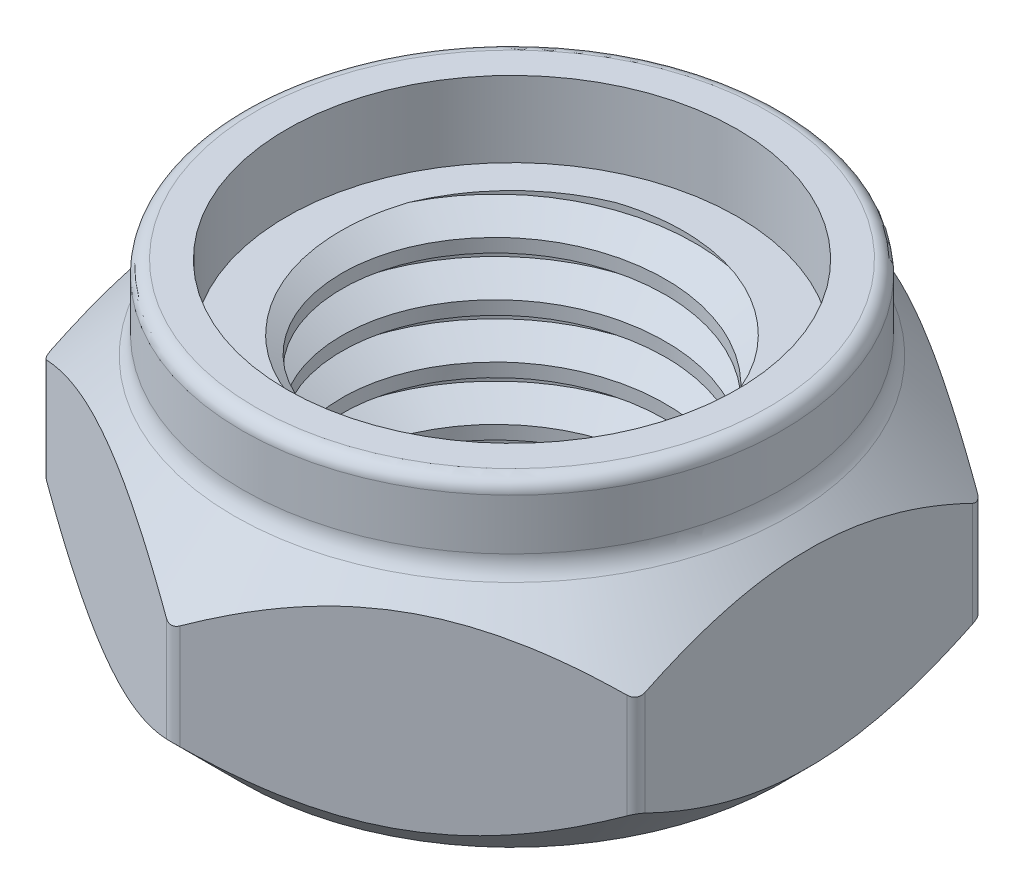
from build123d import *

# Parameters (mm, degrees)
BOSS_EXTRUDE1_DEPTH = 6
SKETCH2_R           = 3
CUT_EXTRUDE1_DEPTH  = 6
THREAD1_PITCH       = 1
SKETCH8_R           = 7.811523021
CUT_EXTRUDE3_DEPTH  = 1.5
SKETCH10_R          = 5
SKETCH10_R_2        = 4.175
BOSS_EXTRUDE2_DEPTH = 1.4
FILLET1_R           = 0.5
FILLET2_R           = 0.25


with BuildPart() as part:
    # Sketch1 → Boss-Extrude1 (new body)
    with BuildSketch(Plane(origin=(0, 0, 0), x_dir=(1, 0, 0), z_dir=(0, 1, 0))):
        Polygon((0, 6.350852961), (-5.5, 3.175426481), (-5.5, -3.175426481), (0, -6.350852961), (5.5, -3.175426481), (5.5, 3.175426481), align=None)
    extrude(amount=BOSS_EXTRUDE1_DEPTH)

    # Sketch2 → Cut-Extrude1 (cut)
    with BuildSketch(Plane(origin=(0, 6, 0), x_dir=(1, 0, 0), z_dir=(0, 1, 0))):
        with Locations(Location((0, 0, 0), (0, 0, 270))):
            Circle(SKETCH2_R)
    extrude(amount=-CUT_EXTRUDE1_DEPTH, mode=Mode.SUBTRACT)

    # Thread1: the profile of Thread Profile1 profile screwed along a right-hand helix of 6 turns, 8 arcs to a turn; built about Z, then put on its axis
    thread1_z = Axis((0, 0, 0), (0, 0, 1))
    thread1_corners = [(2.9997, 0, -0.000173205), (3.541265875, 0, 0.312499999), (3.541265875, 0, 0.437499999), (2.9997, 0, 0.750173202)]
    with BuildLine(mode=Mode.PRIVATE) as thread1_profile:
        Line(thread1_corners[0], thread1_corners[1])
        Line(thread1_corners[1], thread1_corners[2])
        Line(thread1_corners[2], thread1_corners[3])
        Line(thread1_corners[3], thread1_corners[0])
    thread1_cap = Face(thread1_profile.wire())
    thread1_turn_angles = [0, 22.5, 45, 67.5, 90, 112.5, 135, 157.5, 180, 202.5, 225, 247.5, 270, 292.5, 315, 337.5, 360]
    thread1_turn_weights = [1, 0.9238795325112867, 1, 0.9238795325112867, 1, 0.9238795325112867, 1, 0.9238795325112867, 1, 0.9238795325112867, 1, 0.9238795325112867, 1, 0.9238795325112867, 1, 0.9238795325112867, 1]
    thread1_turn_rails = [Edge.make_bspline([Vector(p[0], p[1], 0).rotate(thread1_z, thread1_turn_angles[k]) / thread1_turn_weights[k] + Vector(0, 0, p[2] + THREAD1_PITCH * thread1_turn_angles[k] / 360) for k in range(17)], [0, 0, 0, 1, 1, 2, 2, 3, 3, 4, 4, 5, 5, 6, 6, 7, 7, 8, 8, 8], 2, thread1_turn_weights) for p in thread1_corners]
    thread1_turn_sides = [Face.make_surface_from_curves(thread1_turn_rails[p[0]], thread1_turn_rails[p[1]]) for p in [(0, 1), (1, 2), (2, 3), (3, 0)]]
    thread1 = Plane(origin=(0, 6, 0), x_dir=(-1, 0, 0), z_dir=(0, -1, 0)) * Solid(Shell([*[p.moved(Location((0, 0, THREAD1_PITCH * i))) for i in range(6) for p in thread1_turn_sides], thread1_cap, thread1_cap.rotate(thread1_z, 2160).moved(Location((0, 0, THREAD1_PITCH * 2160 / 360)))]))
    add(thread1, mode=Mode.SUBTRACT)

    # Sketch8 → Cut-Extrude3 (cut)
    with BuildSketch(Plane(origin=(0, 6, 0), x_dir=(1, 0, 0), z_dir=(0, 1, 0))):
        Circle(SKETCH8_R)
    extrude(amount=-CUT_EXTRUDE3_DEPTH, mode=Mode.SUBTRACT)

    # Sketch9 → Cut-Revolve3 (revolve, cut)
    with BuildSketch(Plane.XY, mode=Mode.PRIVATE) as cut_revolve3_sk:
        Polygon((-6.5, 3), (-6.5, 5.5), (-4, 5.5), align=None)
        Polygon((-6.5, 1.5), (-6.5, -1), (-4, -1), align=None)
    revolve(cut_revolve3_sk.sketch.rotate(Axis((0, -1.825523971, 0), (0, 1, 0)), 270), axis=Axis((0, -1.825523971, 0), (0, 1, 0)), mode=Mode.SUBTRACT)

    # Sketch10 → Boss-Extrude2 (add)
    with BuildSketch(Plane(origin=(0, 4.5, 0), x_dir=(1, 0, 0), z_dir=(0, 1, 0))):
        with Locations(Location((0, 0, 0), (0, 0, 270))):
            Circle(SKETCH10_R)
        with Locations(Location((0, 0, 0), (0, 0, 270))):
            Circle(SKETCH10_R_2, mode=Mode.SUBTRACT)
    extrude(amount=BOSS_EXTRUDE2_DEPTH)

    # Fillet1
    fillet1_edges = [part.edges().sort_by_distance(p)[0] for p in [
        (5, 4.5, 0),
    ]]
    fillet(fillet1_edges, radius=FILLET1_R)

    # Fillet2
    # the kernel refuses this fillet: 0.25 mm, written as the material it takes off along each edge
    with BuildSketch(Plane(origin=(0, 0.990009043, -6.350852961), x_dir=(-0.8660254037844386, 0, 0.5000000000000001), z_dir=(0, 1, 0)), Plane(origin=(5.5, 0.990009043, -3.175426481), x_dir=(-0.8660254037844425, 0, -0.49999999999999334), z_dir=(0, 1, 0))) as fillet2_piece_1:
        with BuildLine():
            CenterArc((FILLET2_R * 0.57735026919, FILLET2_R), FILLET2_R, 210, 60)
            Line((-FILLET2_R * 0.288675134595, FILLET2_R * 0.5), (0, 0))
            Line((0, 0), (FILLET2_R * 0.57735026919, 0))
        make_face()
    extrude(amount=2.519981914, mode=Mode.SUBTRACT)
    with BuildSketch(Plane(origin=(5.5, 0.990009043, 3.175426481), x_dir=(-0.8660254037844355, 0, 0.5000000000000052), z_dir=(0, 1, 0)), Plane(origin=(0, 0.990009043, 6.350852961), x_dir=(-0.866025403784443, 0, -0.4999999999999925), z_dir=(0, 1, 0)), Plane(origin=(-5.5, 0.990009043, 3.175426481), x_dir=(0, 0, -1), z_dir=(0, 1, 0)), Plane(origin=(-5.5, 0.990009043, -3.175426481), x_dir=(0.8660254037844372, 0, -0.5000000000000026), z_dir=(0, 1, 0))) as fillet2_piece_2:
        with BuildLine():
            CenterArc((FILLET2_R * 0.57735026919, -FILLET2_R), FILLET2_R, 90, 60)
            Line((-FILLET2_R * 0.288675134595, -FILLET2_R * 0.5), (0, 0))
            Line((0, 0), (FILLET2_R * 0.57735026919, 0))
        make_face()
    extrude(amount=2.519981914, mode=Mode.SUBTRACT)
    with BuildSketch(Plane(origin=(0, 5.9, 0), x_dir=(0, 0, 1), z_dir=(-1, 0, 0))) as fillet2_piece_3:
        with BuildLine():
            CenterArc((5 - FILLET2_R, -FILLET2_R), FILLET2_R, 0, 90)
            Line((5 - FILLET2_R, 0), (5, 0))
            Line((5, 0), (5, -FILLET2_R))
        make_face()
    revolve(axis=Axis((0, 5.9, 0), (0, 1, 0)), mode=Mode.SUBTRACT)


solid = part.part
